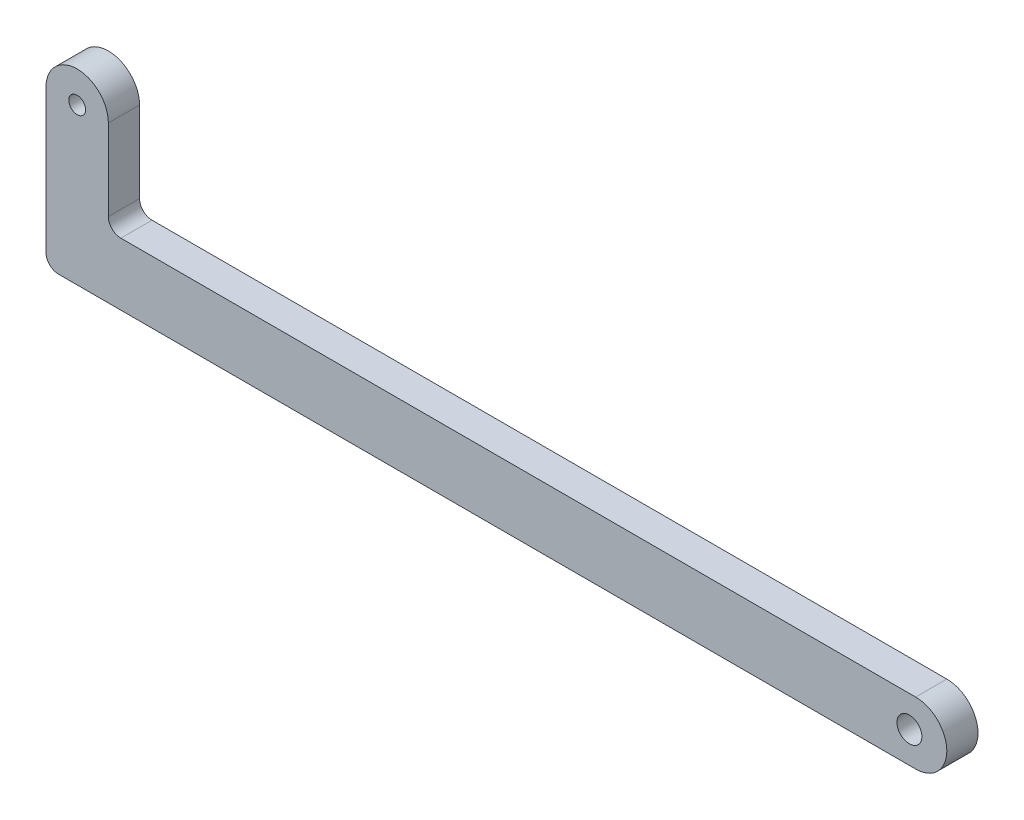
from build123d import *

# Parameters (mm, degrees)
ESQUISSE1_R             = 1.35
BOSS_EXTRU_1_DEPTH      = 5
ESQUISSE4_R             = 2
ENL_V_MAT_EXTRU_1_DEPTH = 148.23423519


with BuildPart() as part:
    # Esquisse1 → Boss.-Extru.1 (new body)
    with BuildSketch(Plane.XY):
        with BuildLine():
            Line((0, 0), (0, 23))
            ThreePointArc((0, 23), (5, 28), (10, 23))
            Line((10, 23), (10, 10))
            ThreePointArc((10, 10), (10.585786438, 8.585786438), (12, 8))
            Line((12, 8), (139.46079057, 8))
            ThreePointArc((139.46079057, 8), (144.46079057, 3), (139.46079057, -2))
            Line((139.46079057, -2), (2, -2))
            ThreePointArc((2, -2), (0.585786438, -1.414213562), (0, 0))
        make_face()
        with Locations((5, 23)):
            Circle(ESQUISSE1_R, mode=Mode.SUBTRACT)
    extrude(amount=BOSS_EXTRU_1_DEPTH)

    # Esquisse4 → Enlèv. mat.-Extru.1 (cut, through all)
    with BuildSketch(Plane.XY.offset(5)):
        with Locations((138.46079057, 3)):
            Circle(ESQUISSE4_R)
    enl_v_mat_extru_1 = extrude(amount=-ENL_V_MAT_EXTRU_1_DEPTH, mode=Mode.SUBTRACT)

    # Symétrie1: Enlèv. mat.-Extru.1 across plane
    add(enl_v_mat_extru_1.mirror(Plane.XY.offset(5)), mode=Mode.SUBTRACT)


solid = part.part
